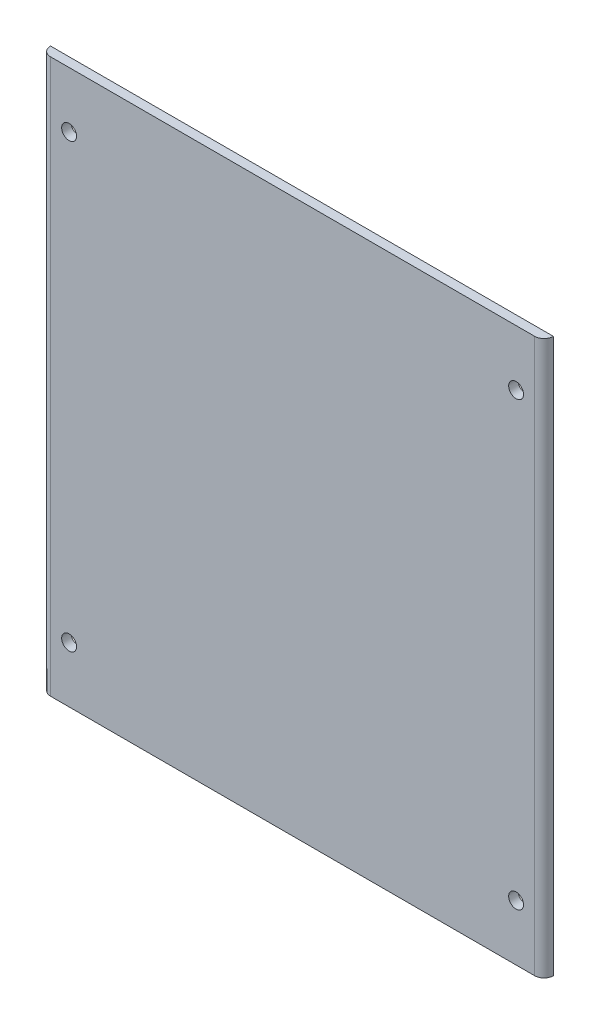
from build123d import *

# Parameters (mm, degrees)
SZKIC1_W                    = 104
SZKIC1_H                    = 118.94
DODANIE_WYCI_GNI_CIE1_DEPTH = 2
SZKIC2_W                    = 2
SZKIC2_H                    = 118.94
DODANIE_WYCI_GNI_CIE2_DEPTH = 2
SZKIC3_R                    = 1.6
WYTNIJ_WYCI_GNI_CIE1_DEPTH  = 2
ZAOKR_GLENIE1_R             = 2


with BuildPart() as part:
    # Szkic1 → Dodanie-wyciągnięcie1 (new body)
    with BuildSketch(Plane.XY):
        with Locations((-56, 59.47)):
            Rectangle(SZKIC1_W, SZKIC1_H)
    extrude(amount=DODANIE_WYCI_GNI_CIE1_DEPTH)

    # Szkic2 → Dodanie-wyciągnięcie2 (add)
    with BuildSketch(Plane(origin=(0, 0, 0), x_dir=(-1, 0, 0), z_dir=(0, 0, -1))):
        with Locations((109, 59.47)):
            Rectangle(SZKIC2_W, SZKIC2_H)
        with Locations((3, 59.47)):
            Rectangle(SZKIC2_W, SZKIC2_H)
    extrude(amount=-DODANIE_WYCI_GNI_CIE2_DEPTH)

    # Szkic3 → Wytnij-wyciągnięcie1 (cut)
    with BuildSketch(Plane.XY.offset(2)):
        with Locations((-104, 12)):
            Circle(SZKIC3_R)
        with Locations((-8, 12)):
            Circle(SZKIC3_R)
        with Locations((-8, 106.94)):
            Circle(SZKIC3_R)
        with Locations((-104, 106.94)):
            Circle(SZKIC3_R)
    extrude(amount=-WYTNIJ_WYCI_GNI_CIE1_DEPTH, mode=Mode.SUBTRACT)

    # Zaokrąglenie1
    zaokr_glenie1_edges = [part.edges().sort_by_distance(p)[0] for p in [
        (-2, 59.47, 2),
        (-110, 59.47, 2),
    ]]
    fillet(zaokr_glenie1_edges, radius=ZAOKR_GLENIE1_R - 0.0001)  # a hair under: the kernel refuses the full size


solid = part.part
